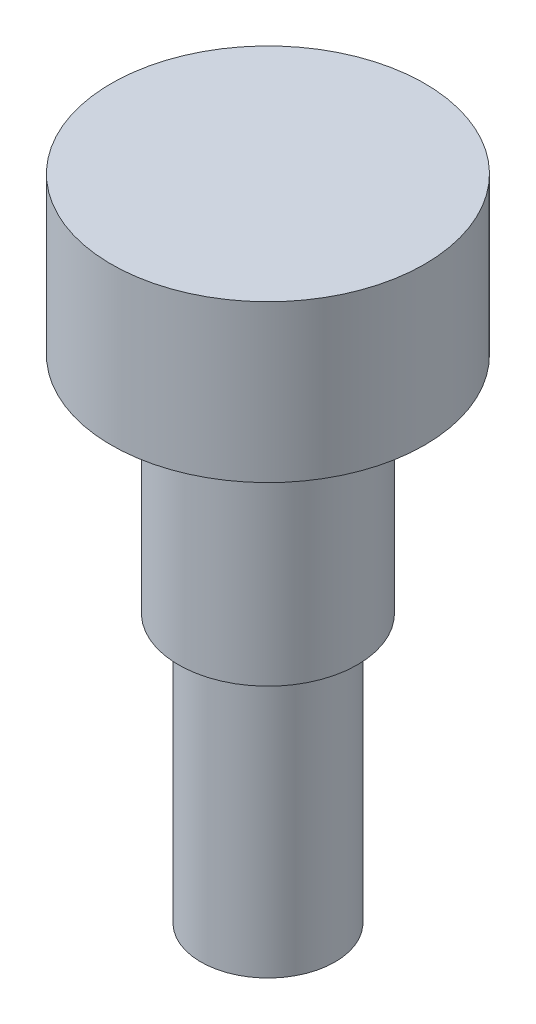
from build123d import *


with BuildPart() as part:
    # 草图1 → 旋转1 (revolve)
    with BuildSketch(Plane.XY):
        Polygon((0, 0), (-3.5, 0), (-3.5, -3.5), (-2, -3.5), (-2, -8.5), (-1.5, -8.5), (-1.5, -14.5), (0, -14.5), align=None)
    revolve(axis=Axis((0, -14.5, 0), (0, 1, 0)))


solid = part.part
